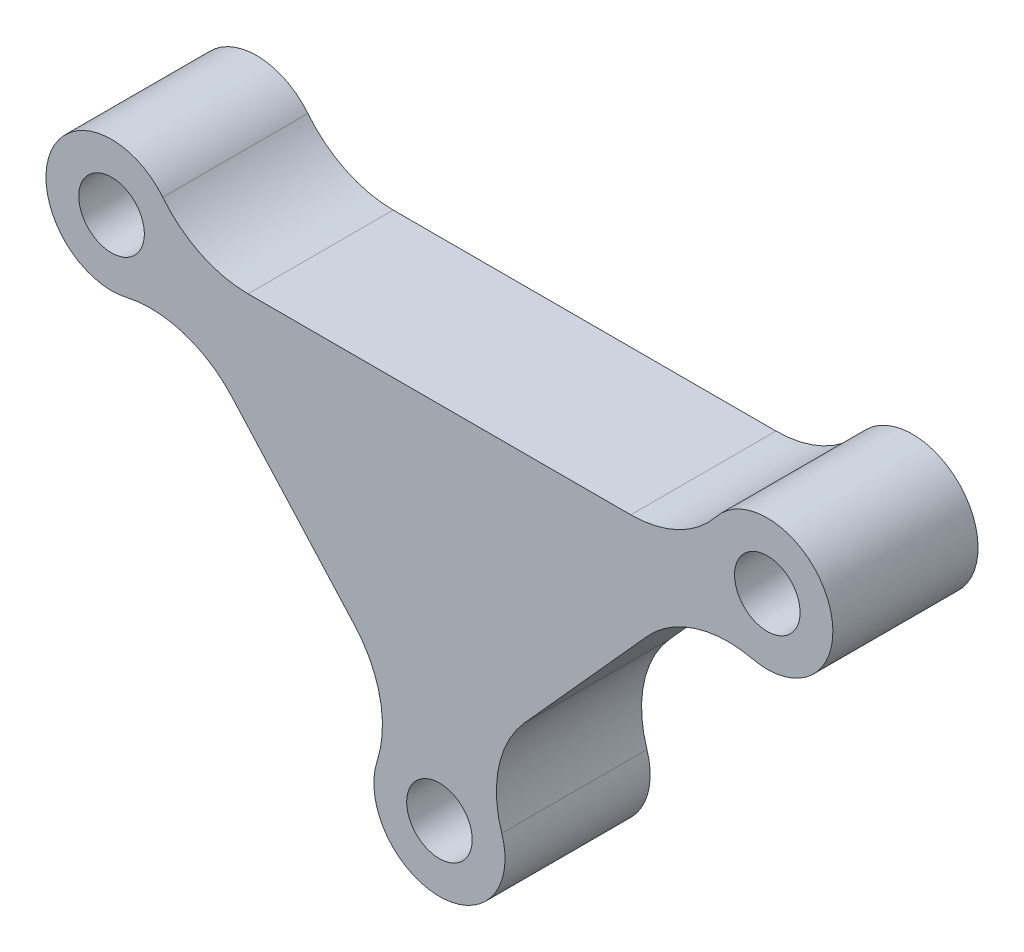
from build123d import *

# Parameters (mm, degrees)
ESQUISSE2_R        = 1.5
BOSS_EXTRU_1_DEPTH = 6.64
CONG_1_R           = 5


with BuildPart() as part:
    # Esquisse2 → Boss.-Extru.1 (new body)
    with BuildSketch(Plane.XY):
        with BuildLine():
            ThreePointArc((-12, 10), (-17.921954275, 10.679840581), (-12.308122144, 8.675691271))
            Line((-12.308122144, 8.675691271), (-1.145444768, -3.727283591))
            ThreePointArc((-1.145444768, -3.727283591), (0, -9.5), (1.145444768, -3.727283591))
            Line((1.145444768, -3.727283591), (12.308122144, 8.675691271))
            ThreePointArc((12.308122144, 8.675691271), (17.921954275, 10.679840581), (12, 10))
            Line((12, 10), (-12, 10))
        make_face()
        with Locations((-15, 10)):
            Circle(ESQUISSE2_R, mode=Mode.SUBTRACT)
        with Locations((15, 10)):
            Circle(ESQUISSE2_R, mode=Mode.SUBTRACT)
        with Locations((0, -6.5)):
            Circle(ESQUISSE2_R, mode=Mode.SUBTRACT)
    extrude(amount=BOSS_EXTRU_1_DEPTH)

    # Congé1
    cong_1_edges = [part.edges().sort_by_distance(p)[0] for p in [
        (-12, 10, 3.32),
        (-12.308122144, 8.675691271, 3.32),
        (-1.145444768, -3.727283591, 3.32),
        (12.308122144, 8.675691271, 3.32),
        (12, 10, 3.32),
        (1.145444768, -3.727283591, 3.32),
    ]]
    fillet(cong_1_edges, radius=CONG_1_R)


solid = part.part
